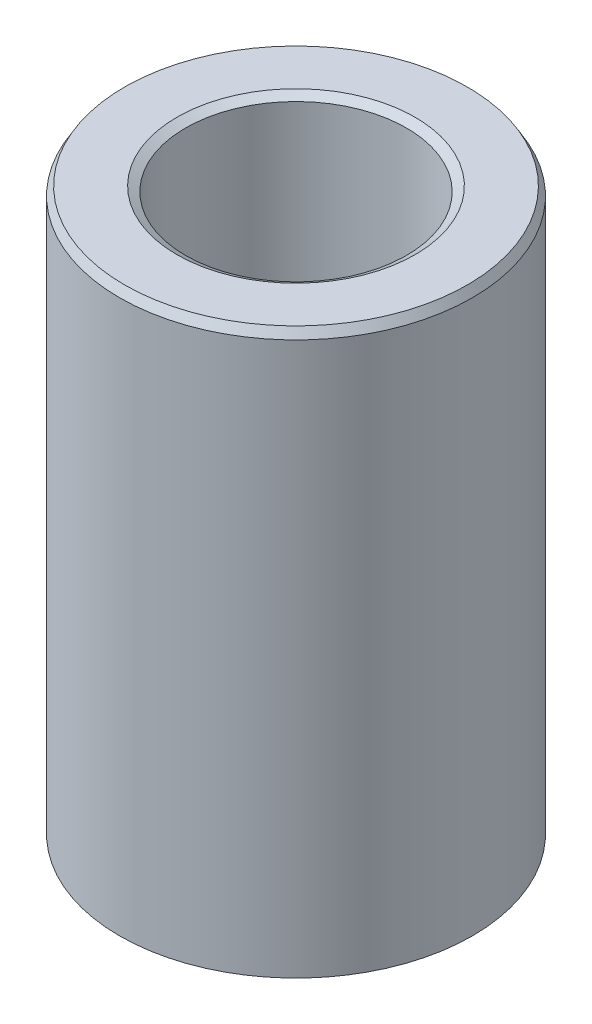
from build123d import *
from OCP.BRepFilletAPI import BRepFilletAPI_MakeChamfer

# Parameters (mm, degrees)
SKETCH1_R           = 27.5
BOSS_EXTRUDE1_DEPTH = 88.280835353
SKETCH2_R           = 17.220894616
CUT_EXTRUDE1_DEPTH  = 97.467641676
CHAMFER1_SIZE       = 1.345081293
CHAMFER1_SIZE2      = 0.776583046


with BuildPart() as part:
    # Sketch1 → Boss-Extrude1 (new body)
    with BuildSketch(Plane(origin=(0, 0, 0), x_dir=(1, 0, 0), z_dir=(0, 1, 0))):
        Circle(SKETCH1_R)
    extrude(amount=BOSS_EXTRUDE1_DEPTH)

    # Sketch2 → Cut-Extrude1 (cut, through all)
    with BuildSketch(Plane(origin=(0, 0, 0), x_dir=(1, 0, 0), z_dir=(0, 1, 0))):
        Circle(SKETCH2_R)
    extrude(amount=CUT_EXTRUDE1_DEPTH, mode=Mode.SUBTRACT)

    # Chamfer1: one chamfer whose edges measure the first distance from different faces: ONE call of the kernel's chamfer builder (chamfer() names one face for all edges)
    chamfer1_edges_1 = [part.edges().sort_by_distance(p)[0] for p in [
        (-17.220894616, 88.280835353, 0),
    ]]
    chamfer1_side_1 = [part.faces().sort_by_distance(p)[0] for p in [
        (-26.722182541, 88.280835353, 0),
    ]]
    chamfer1_edges_2 = [part.edges().sort_by_distance(p)[0] for p in [
        (-17.220894616, 0, 0),
    ]]
    chamfer1_side_2 = [part.faces().sort_by_distance(p)[0] for p in [
        (-17.220894616, 44.140417677, 0),
    ]]
    chamfer1_edges_3 = [part.edges().sort_by_distance(p)[0] for p in [
        (-27.5, 0, 0),
    ]]
    chamfer1_side_3 = [part.faces().sort_by_distance(p)[0] for p in [
        (-26.722182541, 0, 0),
    ]]
    chamfer1_edges_4 = [part.edges().sort_by_distance(p)[0] for p in [
        (-27.5, 88.280835353, 0),
    ]]
    chamfer1_side_4 = [part.faces().sort_by_distance(p)[0] for p in [
        (-27.5, 44.140417677, 0),
    ]]
    chamfer1 = BRepFilletAPI_MakeChamfer(part.part.solid().wrapped)
    for e in chamfer1_edges_1:
        chamfer1.Add(CHAMFER1_SIZE, CHAMFER1_SIZE2, e.wrapped, chamfer1_side_1[0].wrapped)  # the first distance lies on this face
    for e in chamfer1_edges_2:
        chamfer1.Add(CHAMFER1_SIZE, CHAMFER1_SIZE2, e.wrapped, chamfer1_side_2[0].wrapped)  # the first distance lies on this face
    for e in chamfer1_edges_3:
        chamfer1.Add(CHAMFER1_SIZE, CHAMFER1_SIZE2, e.wrapped, chamfer1_side_3[0].wrapped)  # the first distance lies on this face
    for e in chamfer1_edges_4:
        chamfer1.Add(CHAMFER1_SIZE, CHAMFER1_SIZE2, e.wrapped, chamfer1_side_4[0].wrapped)  # the first distance lies on this face
    add(Compound.cast(chamfer1.Shape()), mode=Mode.REPLACE)


solid = part.part
